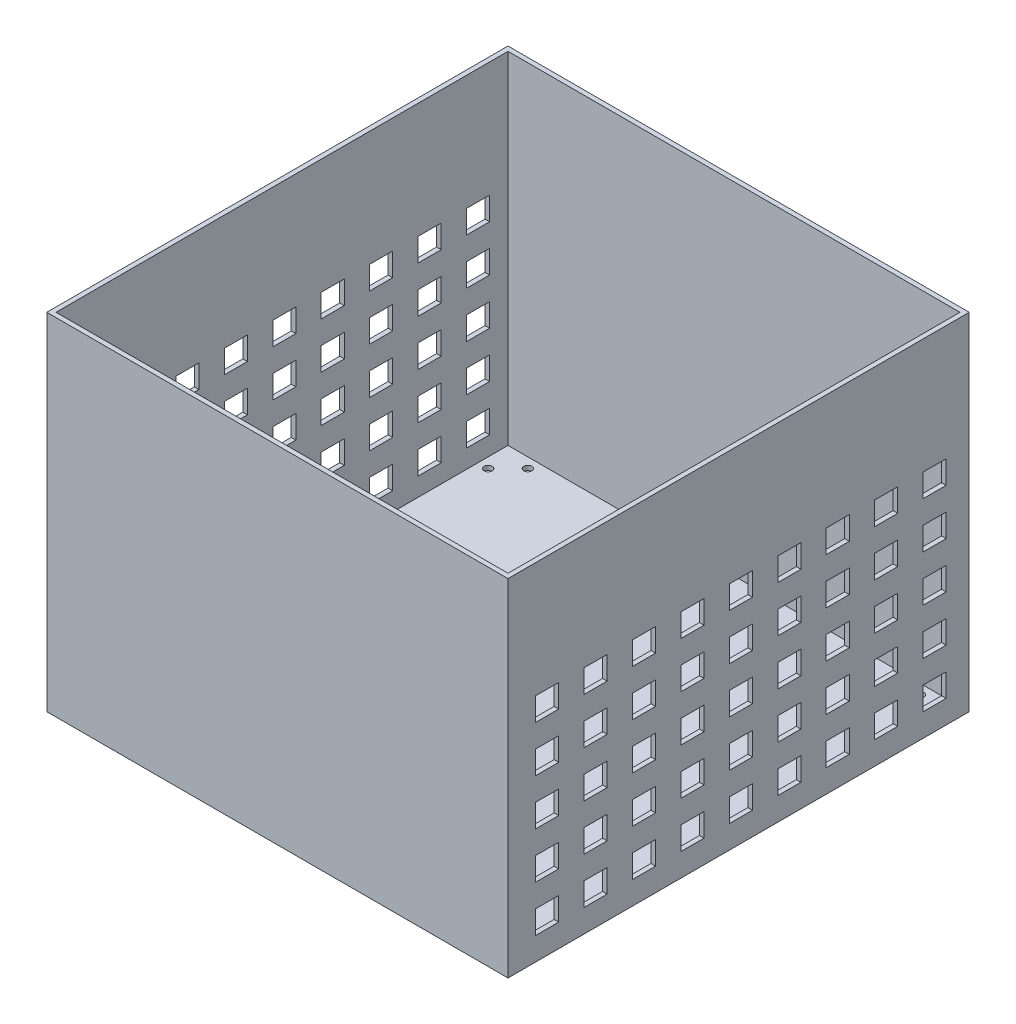
from build123d import *

# Parameters (mm, degrees)
SKETCH_1_W                  = 200
SKETCH_1_H                  = 200
EXTRUDE_1_DEPTH             = 150
SHELL_1_T                   = -2
SKETCH_2_W                  = 10
SKETCH_2_H                  = 10
CUT_EXTRUDE_1_DEPTH         = 474
PATTERN_LINEAR_1_COUNT      = 5
PATTERN_LINEAR_1_PITCH      = 20
PATTERN_LINEAR_1_COUNT_DIR2 = 9
PATTERN_LINEAR_1_PITCH_DIR2 = 21
SKETCH_3_R                  = 1.75
CUT_EXTRUDE_2_DEPTH         = 321.156211872


with BuildPart() as part:
    # 草图1 → 凸台-拉伸1 (new body)
    with BuildSketch(Plane(origin=(0, 0, 0), x_dir=(1, 0, 0), z_dir=(0, 1, 0))):
        with Locations((100, 100)):
            Rectangle(SKETCH_1_W, SKETCH_1_H)
    extrude(amount=EXTRUDE_1_DEPTH)

    # 抽壳1
    shell_1_openings = [part.faces().sort_by_distance(p)[0] for p in [
        (100, 150, -100),
    ]]
    offset(amount=SHELL_1_T, openings=shell_1_openings, kind=Kind.INTERSECTION)

    # 草图2 → 切除-拉伸1 (cut)
    with BuildSketch(Plane.ZY):
        with Locations((-185, 15)):
            Rectangle(SKETCH_2_W, SKETCH_2_H)
    cut_extrude_1 = extrude(amount=-CUT_EXTRUDE_1_DEPTH, mode=Mode.SUBTRACT)

    # 阵列(线性)1: Cut-Extrude 1 5 × 9
    with Locations(*[(0, i * PATTERN_LINEAR_1_PITCH, j * PATTERN_LINEAR_1_PITCH_DIR2) for i in range(PATTERN_LINEAR_1_COUNT) for j in range(PATTERN_LINEAR_1_COUNT_DIR2) if (i, j) != (0, 0)]):
        add(cut_extrude_1, mode=Mode.SUBTRACT)

    # 草图3 → 切除-拉伸2 (cut, through all)
    with BuildSketch(Plane(origin=(0, 0, 0), x_dir=(-1, 0, 0), z_dir=(0, -1, 0))):
        with Locations((-6.363961031, 185)):
            Circle(SKETCH_3_R)
        with Locations((-15, 193.636038969)):
            Circle(SKETCH_3_R)
        with Locations((-185, 193.636038969)):
            Circle(SKETCH_3_R)
        with Locations((-193.636038969, 185)):
            Circle(SKETCH_3_R)
        with Locations((-15, 6.363961031)):
            Circle(SKETCH_3_R)
        with Locations((-6.363961031, 15)):
            Circle(SKETCH_3_R)
        with Locations((-185, 6.363961031)):
            Circle(SKETCH_3_R)
        with Locations((-193.636038969, 15)):
            Circle(SKETCH_3_R)
    extrude(amount=-CUT_EXTRUDE_2_DEPTH, mode=Mode.SUBTRACT)


solid = part.part
